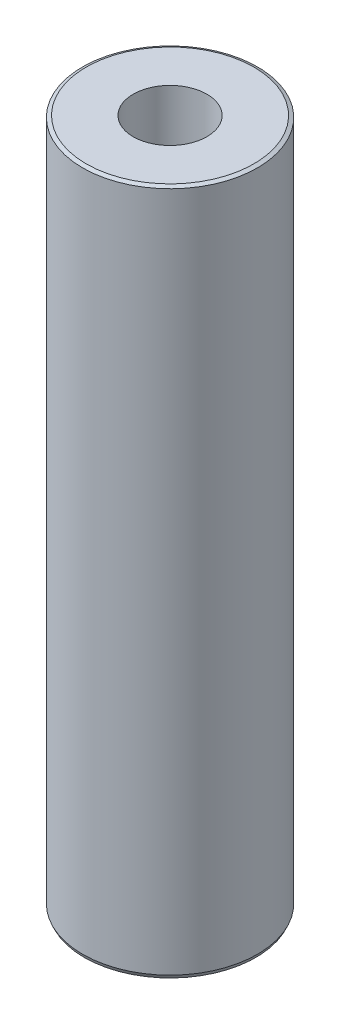
from build123d import *
from OCP.BRepFilletAPI import BRepFilletAPI_MakeChamfer

# Parameters (mm, degrees)
SKETCH1_R           = 57.5
BOSS_EXTRUDE1_DEPTH = 451.131943517
SKETCH2_R           = 24.223351649
CUT_EXTRUDE1_DEPTH  = 459.402149277
CHAMFER1_SIZE       = 1.085945094
CHAMFER1_SIZE2      = 2.381431618


with BuildPart() as part:
    # Sketch1 → Boss-Extrude1 (new body)
    with BuildSketch(Plane(origin=(0, 0, 0), x_dir=(1, 0, 0), z_dir=(0, 1, 0))):
        Circle(SKETCH1_R)
    extrude(amount=BOSS_EXTRUDE1_DEPTH)

    # Sketch2 → Cut-Extrude1 (cut, through all)
    with BuildSketch(Plane(origin=(0, 0, 0), x_dir=(1, 0, 0), z_dir=(0, 1, 0))):
        Circle(SKETCH2_R)
    extrude(amount=CUT_EXTRUDE1_DEPTH, mode=Mode.SUBTRACT)

    # Chamfer1: one chamfer whose edges measure the first distance from different faces: ONE call of the kernel's chamfer builder (chamfer() names one face for all edges)
    chamfer1_edges_1 = [part.edges().sort_by_distance(p)[0] for p in [
        (-57.5, 451.131943517, 0),
    ]]
    chamfer1_side_1 = [part.faces().sort_by_distance(p)[0] for p in [
        (-57.5, 225.565971758, 0),
    ]]
    chamfer1_edges_2 = [part.edges().sort_by_distance(p)[0] for p in [
        (-57.5, 0, 0),
    ]]
    chamfer1_side_2 = [part.faces().sort_by_distance(p)[0] for p in [
        (-55.873654403, 0, 0),
    ]]
    chamfer1 = BRepFilletAPI_MakeChamfer(part.part.solid().wrapped)
    for e in chamfer1_edges_1:
        chamfer1.Add(CHAMFER1_SIZE, CHAMFER1_SIZE2, e.wrapped, chamfer1_side_1[0].wrapped)  # the first distance lies on this face
    for e in chamfer1_edges_2:
        chamfer1.Add(CHAMFER1_SIZE, CHAMFER1_SIZE2, e.wrapped, chamfer1_side_2[0].wrapped)  # the first distance lies on this face
    add(Compound.cast(chamfer1.Shape()), mode=Mode.REPLACE)


solid = part.part
